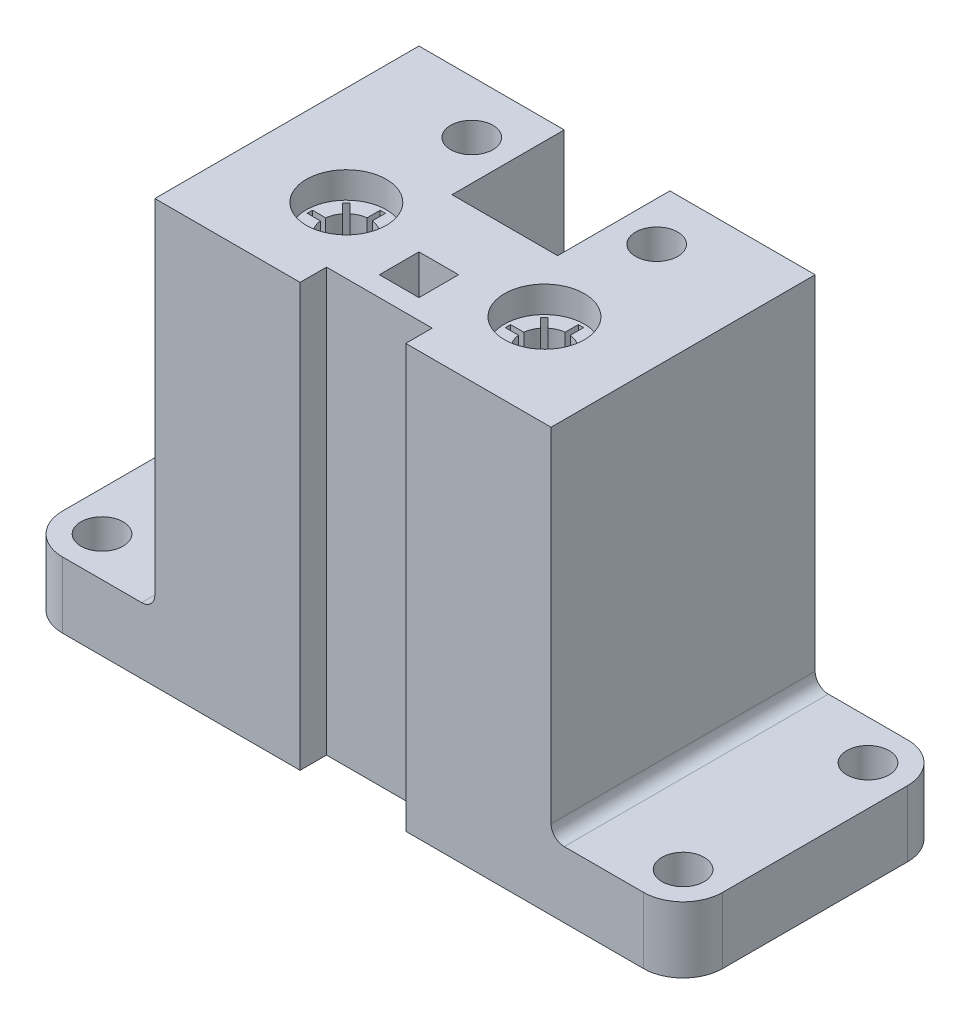
from build123d import *

# Parameters (mm, degrees)
SKETCH_1_W                = 30
SKETCH_1_H                = 20
EXTRUDE_1_DEPTH           = 32
SKETCH_2_R                = 1.775
CUT_EXTRUDE_1_DEPTH       = 4.5
CUT_EXTRUDE_START         = -23
SKETCH_3_R                = 1.775
CUT_EXTRUDE_2_DEPTH       = 4.5
SKETCH_4_W                = 8
SKETCH_4_H                = 8.5
CUT_EXTRUDE_3_DEPTH       = 25
SKETCH_6_R                = 1.675
CUT_EXTRUDE_5_DEPTH       = 33.882366
SKETCH_5_W                = 1
SKETCH_5_H                = 16
CUT_EXTRUDE_4_DEPTH       = 41.607881
SKETCH_7_W                = 8
SKETCH_7_H                = 2
CUT_EXTRUDE_6_DEPTH       = 37.728735
SKETCH_8_R                = 1.6
CUT_EXTRUDE_7_DEPTH       = 6
SKETCH_10_R               = 1.6
CUT_EXTRUDE_8_DEPTH       = 6
CHAMFER_1_SIZE            = 0.5
CUT_EXTRUDE_9_REACH       = 38.729
SKETCH_11_W               = 1
SKETCH_11_H               = 0.4
PATTERN_CIRCULAR_1_COUNT  = 8
SKETCH_12_W               = 1
SKETCH_12_H               = 0.4
CUT_EXTRUDE_10_DEPTH      = 4.5
PATTERN_CIRCULAR_2_COUNT  = 8
MIRROR_1_COPY_1_REACH     = 38.729
MIRROR_1_COPY_1_SKETCH_W  = 1
MIRROR_1_COPY_1_SKETCH_H  = 0.4
MIRROR_1_COPY_2_REACH     = 38.729
MIRROR_1_COPY_2_SKETCH_W  = 1
MIRROR_1_COPY_2_SKETCH_H  = 0.4
MIRROR_1_COPY_3_REACH     = 38.729
MIRROR_1_COPY_3_SKETCH_W  = 1
MIRROR_1_COPY_3_SKETCH_H  = 0.4
MIRROR_1_COPY_4_REACH     = 38.729
MIRROR_1_COPY_4_SKETCH_W  = 1
MIRROR_1_COPY_4_SKETCH_H  = 0.4
MIRROR_1_COPY_5_REACH     = 38.729
MIRROR_1_COPY_5_SKETCH_W  = 1
MIRROR_1_COPY_5_SKETCH_H  = 0.4
MIRROR_1_COPY_6_REACH     = 38.729
MIRROR_1_COPY_6_SKETCH_W  = 1
MIRROR_1_COPY_6_SKETCH_H  = 0.4
MIRROR_1_COPY_7_REACH     = 38.729
MIRROR_1_COPY_7_SKETCH_W  = 1
MIRROR_1_COPY_7_SKETCH_H  = 0.4
MIRROR_1_COPY_8_SKETCH_W  = 1
MIRROR_1_COPY_8_SKETCH_H  = 0.4
MIRROR_1_COPY_8_DEPTH     = 4.5
MIRROR_1_COPY_9_SKETCH_W  = 1
MIRROR_1_COPY_9_SKETCH_H  = 0.4
MIRROR_1_COPY_9_DEPTH     = 4.5
MIRROR_1_COPY_10_SKETCH_W = 1
MIRROR_1_COPY_10_SKETCH_H = 0.4
MIRROR_1_COPY_10_DEPTH    = 4.5
MIRROR_1_COPY_11_SKETCH_W = 1
MIRROR_1_COPY_11_SKETCH_H = 0.4
MIRROR_1_COPY_11_DEPTH    = 4.5
MIRROR_1_COPY_12_SKETCH_W = 1
MIRROR_1_COPY_12_SKETCH_H = 0.4
MIRROR_1_COPY_12_DEPTH    = 4.5
MIRROR_1_COPY_13_SKETCH_W = 1
MIRROR_1_COPY_13_SKETCH_H = 0.4
MIRROR_1_COPY_13_DEPTH    = 4.5
MIRROR_1_COPY_14_SKETCH_W = 1
MIRROR_1_COPY_14_SKETCH_H = 0.4
MIRROR_1_COPY_14_DEPTH    = 4.5
SKETCH_13_W               = 3
SKETCH_13_H               = 3
CUT_EXTRUDE_11_DEPTH      = 4
SKETCH_14_W               = 10
SKETCH_14_H               = 20
EXTRUDE_3_DEPTH           = 5
SKETCH_15_R               = 1.6
CUT_EXTRUDE_12_DEPTH      = 39.131352
FILLET_1_R                = 1
FILLET_2_R                = 3
SKETCH_16_R               = 3.025
CUT_EXTRUDE_13_DEPTH      = 2
EXTRUDE_4_REACH           = 38.069


with BuildPart() as part:
    # 草图1 → 凸台-拉伸1 (new body)
    with BuildSketch(Plane(origin=(0, 0, 0), x_dir=(1, 0, 0), z_dir=(0, 1, 0))):
        Rectangle(SKETCH_1_W, SKETCH_1_H)
    extrude(amount=EXTRUDE_1_DEPTH)

    # 草图2 → 切除-拉伸1 (cut)
    with BuildSketch(Plane(origin=(0, 32, 0), x_dir=(1, 0, 0), z_dir=(0, 1, 0))):
        with Locations(Location((-7.5, -3, 0), (0, 0, 270))):
            Circle(SKETCH_2_R)
        with Locations(Location((7.5, -3, 0), (0, 0, 270))):
            Circle(SKETCH_2_R)
    extrude(amount=-CUT_EXTRUDE_1_DEPTH, mode=Mode.SUBTRACT)

    # 草图3 → 切除-拉伸2 (cut)
    with BuildSketch(Plane(origin=(0, 27.5, 0), x_dir=(1, 0, 0), z_dir=(0, 1, 0)).offset(CUT_EXTRUDE_START)):
        with Locations(Location((-7.5, -3, 0), (0, 0, 270))):
            Circle(SKETCH_3_R)
        with Locations(Location((7.5, -3, 0), (0, 0, 270))):
            Circle(SKETCH_3_R)
    extrude(amount=-CUT_EXTRUDE_2_DEPTH, mode=Mode.SUBTRACT)

    # 草图4 → 切除-拉伸3 (cut)
    with BuildSketch(Plane(origin=(0, 32, 0), x_dir=(1, 0, 0), z_dir=(0, 1, 0))):
        with Locations((0, 5.75)):
            Rectangle(SKETCH_4_W, SKETCH_4_H)
    extrude(amount=-CUT_EXTRUDE_3_DEPTH, mode=Mode.SUBTRACT)

    # 草图6 → 切除-拉伸5 (cut, through all)
    with BuildSketch(Plane(origin=(0, 27.5, 0), x_dir=(1, 0, 0), z_dir=(0, 1, 0))):
        with Locations(Location((7.5, -3, 0), (0, 0, 270))):
            Circle(SKETCH_6_R)
        with Locations(Location((-7.5, -3, 0), (0, 0, 270))):
            Circle(SKETCH_6_R)
    extrude(amount=-CUT_EXTRUDE_5_DEPTH, mode=Mode.SUBTRACT)

    # 草图5 → 切除-拉伸4 (cut, through all)
    with BuildSketch(Plane(origin=(0, 0, -10), x_dir=(-1, 0, 0), z_dir=(0, 0, -1))):
        with Locations((7.5, 16)):
            Rectangle(SKETCH_5_W, SKETCH_5_H)
        with Locations((-7.5, 16)):
            Rectangle(SKETCH_5_W, SKETCH_5_H)
    extrude(amount=-CUT_EXTRUDE_4_DEPTH, mode=Mode.SUBTRACT)

    # 草图7 → 切除-拉伸6 (cut, through all)
    with BuildSketch(Plane(origin=(0, 32, 0), x_dir=(1, 0, 0), z_dir=(0, 1, 0))):
        with Locations((0, -9)):
            Rectangle(SKETCH_7_W, SKETCH_7_H)
    extrude(amount=-CUT_EXTRUDE_6_DEPTH, mode=Mode.SUBTRACT)

    # 草图8 → 切除-拉伸7 (cut)
    with BuildSketch(Plane(origin=(0, 0, -10), x_dir=(-1, 0, 0), z_dir=(0, 0, -1))):
        with Locations((-12, 29)):
            Circle(SKETCH_8_R)
        with Locations(Location((12, 29, 0), (0, 0, 180))):
            Circle(SKETCH_8_R)
        with Locations(Location((-12, 3, 0), (0, 0, 180))):
            Circle(SKETCH_8_R)
        with Locations((12, 3)):
            Circle(SKETCH_8_R)
    extrude(amount=-CUT_EXTRUDE_7_DEPTH, mode=Mode.SUBTRACT)

    # 草图10 → 切除-拉伸8 (cut)
    with BuildSketch(Plane(origin=(0, 32, 0), x_dir=(1, 0, 0), z_dir=(0, 1, 0))):
        with Locations(Location((7, 6, 0), (0, 0, 270))):
            Circle(SKETCH_10_R)
        with Locations(Location((-7, 6, 0), (0, 0, 90))):
            Circle(SKETCH_10_R)
    extrude(amount=-CUT_EXTRUDE_8_DEPTH, mode=Mode.SUBTRACT)

    # 倒角1
    chamfer_1_edges = [part.edges().sort_by_distance(p)[0] for p in [
        (-7.5, 32, 1.225),
        (7.5, 32, 1.225),
        (-7.5, 0, 1.225),
        (7.5, 0, 1.225),
    ]]
    chamfer(chamfer_1_edges, length=CHAMFER_1_SIZE)

    # 切除-拉伸9: up to this face of the body (flat: up to its plane)
    cut_extrude_9_end = Plane(part.part.faces().sort_by_distance((7.5, 27.5, 1.275205))[0])
    # 草图11 → 切除-拉伸9 (cut, up to the picked face)
    with BuildSketch(Plane(origin=(0, 32, 0), x_dir=(1, 0, 0), z_dir=(0, 1, 0)), mode=Mode.PRIVATE) as cut_extrude_9_sk1:
        with Locations((5.236304, -3)):
            Rectangle(SKETCH_11_W, SKETCH_11_H)
    cut_extrude_9_tool1 = split(extrude(cut_extrude_9_sk1.sketch, amount=-CUT_EXTRUDE_9_REACH, mode=Mode.PRIVATE), bisect_by=cut_extrude_9_end, keep=Keep.BOTH, mode=Mode.PRIVATE)
    cut_extrude_9 = cut_extrude_9_tool1.solids().sort_by(Axis((5.236304, 32, 3), (0, -1, 0)))[0]
    add(cut_extrude_9, mode=Mode.SUBTRACT)

    # 阵列(圆周)1: 切除-拉伸9 ×8 about axis
    pattern_circular_1_axis = Axis((7.5, 0, 3), (0, 1, 0))
    for i in range(1, PATTERN_CIRCULAR_1_COUNT):
        add(cut_extrude_9.rotate(pattern_circular_1_axis, i * 360 / PATTERN_CIRCULAR_1_COUNT), mode=Mode.SUBTRACT)

    # 草图12 → 切除-拉伸10 (cut)
    with BuildSketch(Plane.XZ):
        with Locations((5.236304, 3)):
            Rectangle(SKETCH_12_W, SKETCH_12_H)
    cut_extrude_10 = extrude(amount=-CUT_EXTRUDE_10_DEPTH, mode=Mode.SUBTRACT)

    # 阵列(圆周)2: 切除-拉伸10 ×8 about axis
    pattern_circular_2_axis = Axis((7.5, 0, 3), (0, 1, 0))
    for i in range(1, PATTERN_CIRCULAR_2_COUNT):
        add(cut_extrude_10.rotate(pattern_circular_2_axis, i * 360 / PATTERN_CIRCULAR_2_COUNT), mode=Mode.SUBTRACT)

    # 镜向1: 切除-拉伸9, 切除-拉伸10 across plane
    add(cut_extrude_9.mirror(Plane(origin=(0, 0, 0), x_dir=(0, 0, 1), z_dir=(1, 0, 0))), mode=Mode.SUBTRACT)
    add(cut_extrude_10.mirror(Plane(origin=(0, 0, 0), x_dir=(0, 0, 1), z_dir=(1, 0, 0))), mode=Mode.SUBTRACT)

    # 镜向1 copy 1: up to this face of the body (flat: up to its plane)
    mirror_1_copy_1_end = Plane(part.part.faces().sort_by_distance((-6.280385, 27.5, 1.780385))[0])
    # 镜向1 copy 1 sketch → 镜向1 copy 1 (cut, up to the picked face)
    with BuildSketch(Plane(origin=(-0.075379, 32, 6.181981), x_dir=(-0.7071067811865476, 0, -0.7071067811865475), z_dir=(0, 1, 0)), mode=Mode.PRIVATE) as mirror_1_copy_1_sk1:
        with Locations((5.236304, 3)):
            Rectangle(MIRROR_1_COPY_1_SKETCH_W, MIRROR_1_COPY_1_SKETCH_H)
    mirror_1_copy_1_tool1 = split(extrude(mirror_1_copy_1_sk1.sketch, amount=-MIRROR_1_COPY_1_REACH, mode=Mode.PRIVATE), bisect_by=mirror_1_copy_1_end, keep=Keep.BOTH, mode=Mode.PRIVATE)
    add(mirror_1_copy_1_tool1.solids().sort_by(Axis((-5.899325, 32, 4.600675), (0, -1, 0)))[0], mode=Mode.SUBTRACT)

    # 镜向1 copy 2: up to this face of the body (flat: up to its plane)
    mirror_1_copy_2_end = Plane(part.part.faces().sort_by_distance((-5.775205, 27.5, 3))[0])
    # 镜向1 copy 2 sketch → 镜向1 copy 2 (cut, up to the picked face)
    with BuildSketch(Plane(origin=(-4.5, 32, 10.5), x_dir=(0, 0, -1), z_dir=(0, 1, 0)), mode=Mode.PRIVATE) as mirror_1_copy_2_sk1:
        with Locations((5.236304, 3)):
            Rectangle(MIRROR_1_COPY_2_SKETCH_W, MIRROR_1_COPY_2_SKETCH_H)
    mirror_1_copy_2_tool1 = split(extrude(mirror_1_copy_2_sk1.sketch, amount=-MIRROR_1_COPY_2_REACH, mode=Mode.PRIVATE), bisect_by=mirror_1_copy_2_end, keep=Keep.BOTH, mode=Mode.PRIVATE)
    add(mirror_1_copy_2_tool1.solids().sort_by(Axis((-7.5, 32, 5.263696), (0, -1, 0)))[0], mode=Mode.SUBTRACT)

    # 镜向1 copy 3: up to this face of the body (flat: up to its plane)
    mirror_1_copy_3_end = Plane(part.part.faces().sort_by_distance((-6.280385, 27.5, 4.219615))[0])
    # 镜向1 copy 3 sketch → 镜向1 copy 3 (cut, up to the picked face)
    with BuildSketch(Plane(origin=(-10.681981, 32, 10.424621), x_dir=(0.7071067811865475, 0, -0.7071067811865476), z_dir=(0, 1, 0)), mode=Mode.PRIVATE) as mirror_1_copy_3_sk1:
        with Locations((5.236304, 3)):
            Rectangle(MIRROR_1_COPY_3_SKETCH_W, MIRROR_1_COPY_3_SKETCH_H)
    mirror_1_copy_3_tool1 = split(extrude(mirror_1_copy_3_sk1.sketch, amount=-MIRROR_1_COPY_3_REACH, mode=Mode.PRIVATE), bisect_by=mirror_1_copy_3_end, keep=Keep.BOTH, mode=Mode.PRIVATE)
    add(mirror_1_copy_3_tool1.solids().sort_by(Axis((-9.100675, 32, 4.600675), (0, -1, 0)))[0], mode=Mode.SUBTRACT)

    # 镜向1 copy 4: up to this face of the body (flat: up to its plane)
    mirror_1_copy_4_end = Plane(part.part.faces().sort_by_distance((-7.5, 27.5, 4.724795))[0])
    # 镜向1 copy 4 sketch → 镜向1 copy 4 (cut, up to the picked face)
    with BuildSketch(Plane(origin=(-15, 32, 6), x_dir=(1, 0, 0), z_dir=(0, 1, 0)), mode=Mode.PRIVATE) as mirror_1_copy_4_sk1:
        with Locations((5.236304, 3)):
            Rectangle(MIRROR_1_COPY_4_SKETCH_W, MIRROR_1_COPY_4_SKETCH_H)
    mirror_1_copy_4_tool1 = split(extrude(mirror_1_copy_4_sk1.sketch, amount=-MIRROR_1_COPY_4_REACH, mode=Mode.PRIVATE), bisect_by=mirror_1_copy_4_end, keep=Keep.BOTH, mode=Mode.PRIVATE)
    add(mirror_1_copy_4_tool1.solids().sort_by(Axis((-9.763696, 32, 3), (0, -1, 0)))[0], mode=Mode.SUBTRACT)

    # 镜向1 copy 5: up to this face of the body (flat: up to its plane)
    mirror_1_copy_5_end = Plane(part.part.faces().sort_by_distance((-8.719615, 27.5, 4.219615))[0])
    # 镜向1 copy 5 sketch → 镜向1 copy 5 (cut, up to the picked face)
    with BuildSketch(Plane(origin=(-14.924621, 32, -0.181981), x_dir=(0.7071067811865477, 0, 0.7071067811865475), z_dir=(0, 1, 0)), mode=Mode.PRIVATE) as mirror_1_copy_5_sk1:
        with Locations((5.236304, 3)):
            Rectangle(MIRROR_1_COPY_5_SKETCH_W, MIRROR_1_COPY_5_SKETCH_H)
    mirror_1_copy_5_tool1 = split(extrude(mirror_1_copy_5_sk1.sketch, amount=-MIRROR_1_COPY_5_REACH, mode=Mode.PRIVATE), bisect_by=mirror_1_copy_5_end, keep=Keep.BOTH, mode=Mode.PRIVATE)
    add(mirror_1_copy_5_tool1.solids().sort_by(Axis((-9.100675, 32, 1.399325), (0, -1, 0)))[0], mode=Mode.SUBTRACT)

    # 镜向1 copy 6: up to this face of the body (flat: up to its plane)
    mirror_1_copy_6_end = Plane(part.part.faces().sort_by_distance((-9.224795, 27.5, 3))[0])
    # 镜向1 copy 6 sketch → 镜向1 copy 6 (cut, up to the picked face)
    with BuildSketch(Plane(origin=(-10.5, 32, -4.5), x_dir=(0, 0, 1), z_dir=(0, 1, 0)), mode=Mode.PRIVATE) as mirror_1_copy_6_sk1:
        with Locations((5.236304, 3)):
            Rectangle(MIRROR_1_COPY_6_SKETCH_W, MIRROR_1_COPY_6_SKETCH_H)
    mirror_1_copy_6_tool1 = split(extrude(mirror_1_copy_6_sk1.sketch, amount=-MIRROR_1_COPY_6_REACH, mode=Mode.PRIVATE), bisect_by=mirror_1_copy_6_end, keep=Keep.BOTH, mode=Mode.PRIVATE)
    add(mirror_1_copy_6_tool1.solids().sort_by(Axis((-7.5, 32, 0.736304), (0, -1, 0)))[0], mode=Mode.SUBTRACT)

    # 镜向1 copy 7: up to this face of the body (flat: up to its plane)
    mirror_1_copy_7_end = Plane(part.part.faces().sort_by_distance((-8.719615, 27.5, 1.780385))[0])
    # 镜向1 copy 7 sketch → 镜向1 copy 7 (cut, up to the picked face)
    with BuildSketch(Plane(origin=(-4.318019, 32, -4.424621), x_dir=(-0.7071067811865474, 0, 0.7071067811865477), z_dir=(0, 1, 0)), mode=Mode.PRIVATE) as mirror_1_copy_7_sk1:
        with Locations((5.236304, 3)):
            Rectangle(MIRROR_1_COPY_7_SKETCH_W, MIRROR_1_COPY_7_SKETCH_H)
    mirror_1_copy_7_tool1 = split(extrude(mirror_1_copy_7_sk1.sketch, amount=-MIRROR_1_COPY_7_REACH, mode=Mode.PRIVATE), bisect_by=mirror_1_copy_7_end, keep=Keep.BOTH, mode=Mode.PRIVATE)
    add(mirror_1_copy_7_tool1.solids().sort_by(Axis((-5.899325, 32, 1.399325), (0, -1, 0)))[0], mode=Mode.SUBTRACT)

    # 镜向1 copy 8 sketch → 镜向1 copy 8 (cut)
    with BuildSketch(Plane(origin=(-0.075379, 0, 6.181981), x_dir=(-0.7071067811865476, 0, -0.7071067811865475), z_dir=(0, -1, 0))):
        with Locations((5.236304, -3)):
            Rectangle(MIRROR_1_COPY_8_SKETCH_W, MIRROR_1_COPY_8_SKETCH_H)
    extrude(amount=-MIRROR_1_COPY_8_DEPTH, mode=Mode.SUBTRACT)

    # 镜向1 copy 9 sketch → 镜向1 copy 9 (cut)
    with BuildSketch(Plane(origin=(-4.5, 0, 10.5), x_dir=(0, 0, -1), z_dir=(0, -1, 0))):
        with Locations((5.236304, -3)):
            Rectangle(MIRROR_1_COPY_9_SKETCH_W, MIRROR_1_COPY_9_SKETCH_H)
    extrude(amount=-MIRROR_1_COPY_9_DEPTH, mode=Mode.SUBTRACT)

    # 镜向1 copy 10 sketch → 镜向1 copy 10 (cut)
    with BuildSketch(Plane(origin=(-10.681981, 0, 10.424621), x_dir=(0.7071067811865475, 0, -0.7071067811865476), z_dir=(0, -1, 0))):
        with Locations((5.236304, -3)):
            Rectangle(MIRROR_1_COPY_10_SKETCH_W, MIRROR_1_COPY_10_SKETCH_H)
    extrude(amount=-MIRROR_1_COPY_10_DEPTH, mode=Mode.SUBTRACT)

    # 镜向1 copy 11 sketch → 镜向1 copy 11 (cut)
    with BuildSketch(Plane(origin=(-15, 0, 6), x_dir=(1, 0, 0), z_dir=(0, -1, 0))):
        with Locations((5.236304, -3)):
            Rectangle(MIRROR_1_COPY_11_SKETCH_W, MIRROR_1_COPY_11_SKETCH_H)
    extrude(amount=-MIRROR_1_COPY_11_DEPTH, mode=Mode.SUBTRACT)

    # 镜向1 copy 12 sketch → 镜向1 copy 12 (cut)
    with BuildSketch(Plane(origin=(-14.924621, 0, -0.181981), x_dir=(0.7071067811865477, 0, 0.7071067811865475), z_dir=(0, -1, 0))):
        with Locations((5.236304, -3)):
            Rectangle(MIRROR_1_COPY_12_SKETCH_W, MIRROR_1_COPY_12_SKETCH_H)
    extrude(amount=-MIRROR_1_COPY_12_DEPTH, mode=Mode.SUBTRACT)

    # 镜向1 copy 13 sketch → 镜向1 copy 13 (cut)
    with BuildSketch(Plane(origin=(-10.5, 0, -4.5), x_dir=(0, 0, 1), z_dir=(0, -1, 0))):
        with Locations((5.236304, -3)):
            Rectangle(MIRROR_1_COPY_13_SKETCH_W, MIRROR_1_COPY_13_SKETCH_H)
    extrude(amount=-MIRROR_1_COPY_13_DEPTH, mode=Mode.SUBTRACT)

    # 镜向1 copy 14 sketch → 镜向1 copy 14 (cut)
    with BuildSketch(Plane(origin=(-4.318019, 0, -4.424621), x_dir=(-0.7071067811865474, 0, 0.7071067811865477), z_dir=(0, -1, 0))):
        with Locations((5.236304, -3)):
            Rectangle(MIRROR_1_COPY_14_SKETCH_W, MIRROR_1_COPY_14_SKETCH_H)
    extrude(amount=-MIRROR_1_COPY_14_DEPTH, mode=Mode.SUBTRACT)

    # 草图13 → 切除-拉伸11 (cut)
    with BuildSketch(Plane(origin=(0, 32, 0), x_dir=(1, 0, 0), z_dir=(0, 1, 0))):
        with Locations((0, -5)):
            Rectangle(SKETCH_13_W, SKETCH_13_H)
    extrude(amount=-CUT_EXTRUDE_11_DEPTH, mode=Mode.SUBTRACT)

    # 草图14 → 凸台-拉伸3 (add)
    with BuildSketch(Plane.XZ):
        with Locations((20, 0)):
            Rectangle(SKETCH_14_W, SKETCH_14_H)
    extrude_3 = extrude(amount=-EXTRUDE_3_DEPTH)

    # 草图15 → 切除-拉伸12 (cut, through all)
    with BuildSketch(Plane(origin=(0, 5, 0), x_dir=(1, 0, 0), z_dir=(0, 1, 0))):
        with Locations(Location((22, 7, 0), (0, 0, 270))):
            Circle(SKETCH_15_R)
        with Locations(Location((22, -7, 0), (0, 0, 90))):
            Circle(SKETCH_15_R)
    cut_extrude_12 = extrude(amount=-CUT_EXTRUDE_12_DEPTH, mode=Mode.SUBTRACT)

    # 镜向6: 凸台-拉伸3, 切除-拉伸12 across plane
    add(extrude_3.mirror(Plane(origin=(0, 0, 0), x_dir=(0, 0, 1), z_dir=(1, 0, 0))))
    add(cut_extrude_12.mirror(Plane(origin=(0, 0, 0), x_dir=(0, 0, 1), z_dir=(1, 0, 0))), mode=Mode.SUBTRACT)

    # 圆角1
    fillet_1_edges = [part.edges().sort_by_distance(p)[0] for p in [
        (15, 5, 0),
        (-15, 5, 0),
    ]]
    fillet(fillet_1_edges, radius=FILLET_1_R)

    # 圆角2
    fillet_2_edges = [part.edges().sort_by_distance(p)[0] for p in [
        (25, 2.5, 10),
        (25, 2.5, -10),
        (-25, 2.5, -10),
        (-25, 2.5, 10),
    ]]
    fillet(fillet_2_edges, radius=FILLET_2_R)

    # 草图16 → 切除-拉伸13 (cut)
    with BuildSketch(Plane(origin=(0, 32, 0), x_dir=(1, 0, 0), z_dir=(0, 1, 0))):
        with Locations(Location((-7.5, -3, 0), (0, 0, 270))):
            Circle(SKETCH_16_R)
        with Locations(Location((7.5, -3, 0), (0, 0, 90))):
            Circle(SKETCH_16_R)
    cut_extrude_13 = extrude(amount=-CUT_EXTRUDE_13_DEPTH, mode=Mode.SUBTRACT)

    # 镜向7: 切除-拉伸13 across plane
    add(cut_extrude_13.mirror(Plane.ZX.offset(16)), mode=Mode.SUBTRACT)

    # 草图17 → 凸台-拉伸4 (add, up to next)
    with BuildSketch(Plane(origin=(0, 8, 0), x_dir=(1, 0, 0), z_dir=(0, 1, 0)), mode=Mode.PRIVATE) as extrude_4_sk1:
        with BuildLine():
            Line((-7, -1.401368), (-7, 10))
            Line((-7, 10), (-8, 10))
            Line((-8, 10), (-8, -1.401368))
            ThreePointArc((-8, -1.401368), (-7.5, -1.325), (-7, -1.401368))
        make_face()
    extrude_4_tool1 = extrude(extrude_4_sk1.sketch, amount=EXTRUDE_4_REACH, mode=Mode.PRIVATE) - part.part
    # 草图17 → 凸台-拉伸4 (add, up to next)
    with BuildSketch(Plane(origin=(0, 8, 0), x_dir=(1, 0, 0), z_dir=(0, 1, 0)), mode=Mode.PRIVATE) as extrude_4_sk2:
        with BuildLine():
            Line((8, -1.401368), (8, 10))
            Line((8, 10), (7, 10))
            Line((7, 10), (7, -1.401368))
            ThreePointArc((7, -1.401368), (7.5, -1.325), (8, -1.401368))
        make_face()
    extrude_4_tool2 = extrude(extrude_4_sk2.sketch, amount=EXTRUDE_4_REACH, mode=Mode.PRIVATE) - part.part
    # 草图17 → 凸台-拉伸4 (add, up to next)
    with BuildSketch(Plane(origin=(0, 8, 0), x_dir=(1, 0, 0), z_dir=(0, 1, 0)), mode=Mode.PRIVATE) as extrude_4_sk3:
        with BuildLine():
            Line((-8, -4.598632), (-8, -10))
            Line((-8, -10), (-7, -10))
            Line((-7, -10), (-7, -4.598632))
            ThreePointArc((-7, -4.598632), (-7.5, -4.675), (-8, -4.598632))
        make_face()
    extrude_4_tool3 = extrude(extrude_4_sk3.sketch, amount=EXTRUDE_4_REACH, mode=Mode.PRIVATE) - part.part
    # 草图17 → 凸台-拉伸4 (add, up to next)
    with BuildSketch(Plane(origin=(0, 8, 0), x_dir=(1, 0, 0), z_dir=(0, 1, 0)), mode=Mode.PRIVATE) as extrude_4_sk4:
        with BuildLine():
            Line((7, -4.598632), (7, -10))
            Line((7, -10), (8, -10))
            Line((8, -10), (8, -4.598632))
            ThreePointArc((8, -4.598632), (7.5, -4.675), (7, -4.598632))
        make_face()
    extrude_4_tool4 = extrude(extrude_4_sk4.sketch, amount=EXTRUDE_4_REACH, mode=Mode.PRIVATE) - part.part
    add(extrude_4_tool1.solids().sort_by_distance((-7.5, 8, -4.324868))[0])
    add(extrude_4_tool2.solids().sort_by_distance((7.5, 8, -4.324868))[0])
    add(extrude_4_tool3.solids().sort_by_distance((-7.5, 8, 7.324842))[0])
    add(extrude_4_tool4.solids().sort_by_distance((7.5, 8, 7.324842))[0])


solid = part.part
